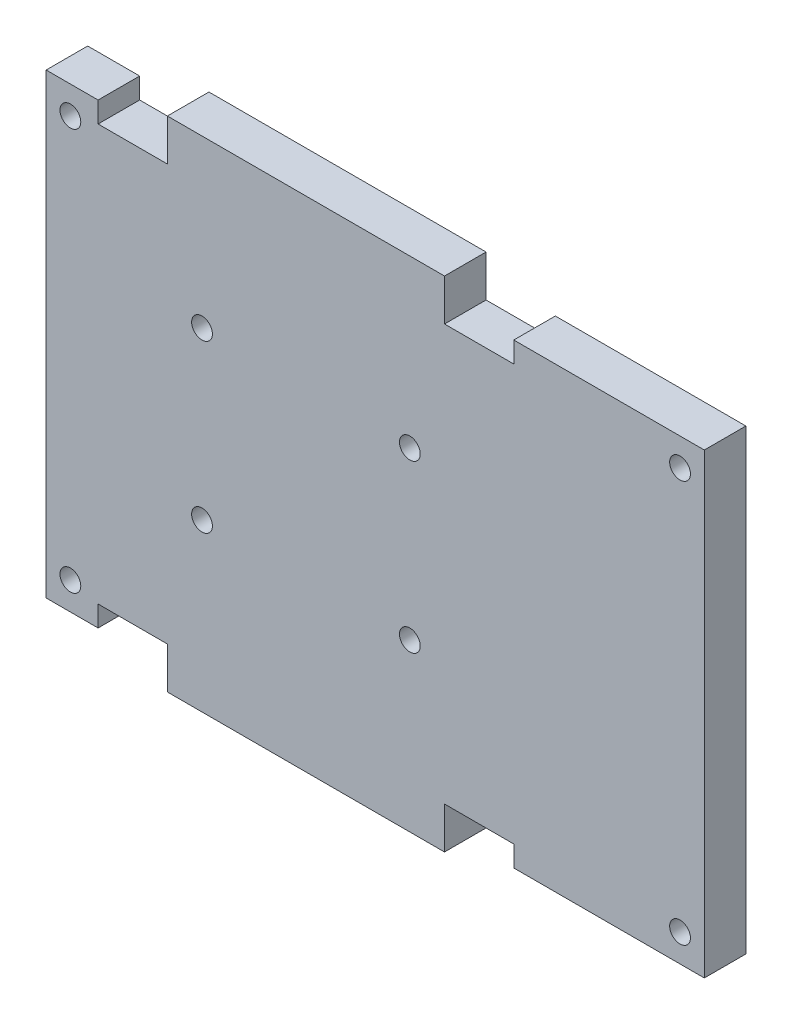
from build123d import *

# Parameters (mm, degrees)
SKETCH1_W               = 60
SKETCH1_H               = 72
BOSS_EXTRUDE1_DEPTH     = 6
CUT_EXTRUDE1_DEPTH      = 48.244047244
CUT_EXTRUDE1_DEPTH_BACK = 48.244047244
SKETCH2_W               = 10
SKETCH2_H               = 6
CUT_EXTRUDE2_DEPTH      = 48.244047244
CUT_EXTRUDE2_DEPTH_BACK = 48.244047244
SKETCH3_R               = 1.5
SKETCH6_W               = 6
SKETCH6_H               = 66
BOSS_EXTRUDE2_DEPTH     = 27.5
SKETCH7_W               = 6
SKETCH7_H               = 66
BOSS_EXTRUDE3_DEPTH     = 7.5
SKETCH8_R               = 1.5
CUT_EXTRUDE3_DEPTH      = 69.10469881


with BuildPart() as part:
    # Sketch1 → Boss-Extrude1 (new body)
    with BuildSketch(Plane.XY):
        Rectangle(SKETCH1_W, SKETCH1_H)
    extrude(amount=BOSS_EXTRUDE1_DEPTH)

    # Sketch2 → Cut-Extrude1 (cut, two sides: drawn at the far end of the back side and taken through both)
    with BuildSketch(Plane.XY.offset(6).offset(-CUT_EXTRUDE1_DEPTH_BACK)):
        with Locations((-25, 33)):
            Rectangle(SKETCH2_W, SKETCH2_H)
        with Locations((-25, -33)):
            Rectangle(SKETCH2_W, SKETCH2_H)
        with Locations((25, -33)):
            Rectangle(SKETCH2_W, SKETCH2_H)
        with Locations((25, 33)):
            Rectangle(SKETCH2_W, SKETCH2_H)
    extrude(amount=CUT_EXTRUDE1_DEPTH + CUT_EXTRUDE1_DEPTH_BACK, mode=Mode.SUBTRACT)

    # Sketch3 → Cut-Extrude2 (cut, two sides: drawn at the far end of the back side and taken through both)
    with BuildSketch(Plane.XY.offset(6).offset(-CUT_EXTRUDE2_DEPTH_BACK)):
        with Locations((-15, 12)):
            Circle(SKETCH3_R)
        with Locations((-15, -12)):
            Circle(SKETCH3_R)
        with Locations((15, -12)):
            Circle(SKETCH3_R)
        with Locations((15, 12)):
            Circle(SKETCH3_R)
    extrude(amount=CUT_EXTRUDE2_DEPTH + CUT_EXTRUDE2_DEPTH_BACK, mode=Mode.SUBTRACT)

    # Sketch6 → Boss-Extrude2 (add)
    with BuildSketch(Plane(origin=(30, 0, 0), x_dir=(0, 0, -1), z_dir=(1, 0, 0))):
        with Locations((-3, 0)):
            Rectangle(SKETCH6_W, SKETCH6_H)
    extrude(amount=BOSS_EXTRUDE2_DEPTH)

    # Sketch7 → Boss-Extrude3 (add)
    with BuildSketch(Plane.ZY.offset(30)):
        with Locations((3, 0)):
            Rectangle(SKETCH7_W, SKETCH7_H)
    extrude(amount=BOSS_EXTRUDE3_DEPTH)

    # Sketch8 → Cut-Extrude3 (cut, through all)
    with BuildSketch(Plane.XY.offset(6)):
        with Locations((54, -29)):
            Circle(SKETCH8_R)
        with Locations((54, 29)):
            Circle(SKETCH8_R)
        with Locations((-34, 29)):
            Circle(SKETCH8_R)
        with Locations((-34, -29)):
            Circle(SKETCH8_R)
    extrude(amount=-CUT_EXTRUDE3_DEPTH, mode=Mode.SUBTRACT)


solid = part.part
